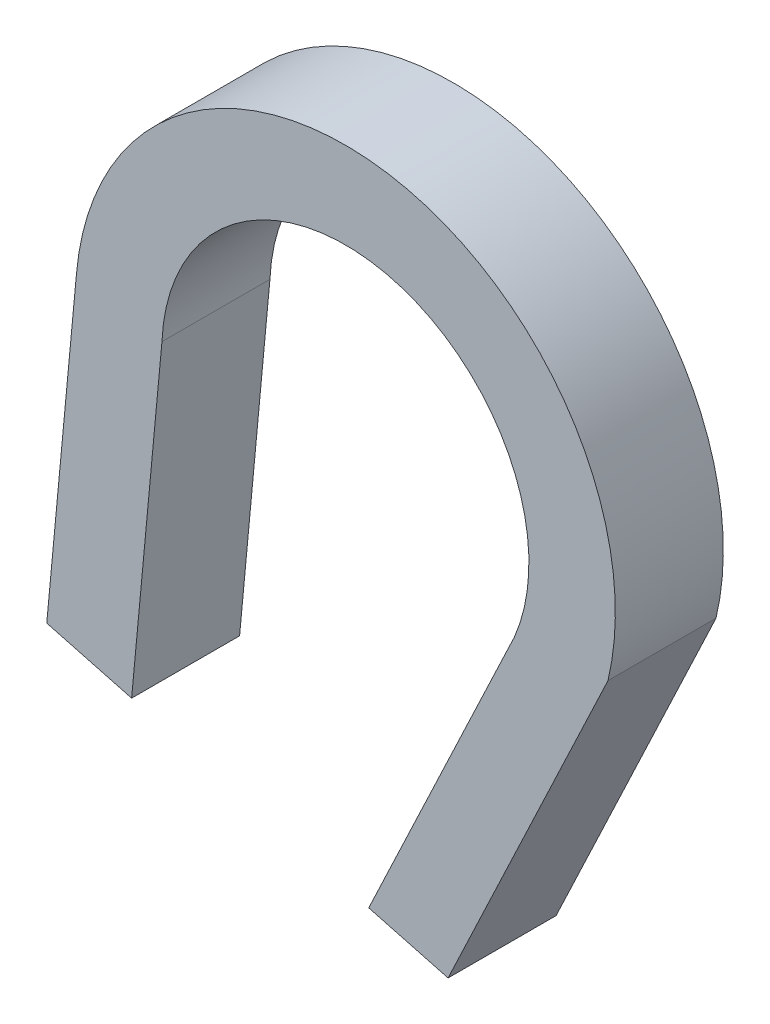
from build123d import *

# Parameters (mm, degrees)
BOSS_EXTRUDE3_DEPTH = 10


with BuildPart() as part:
    # Sketch1 → Boss-Extrude3 (new body)
    with BuildSketch(Plane.XY):
        with BuildLine():
            ThreePointArc((-16.983639344, 0.745650472), (4.47244562, 16.401135027), (15.011154971, -7.97904922))
            Line((15.011154971, -7.97904922), (2.166364839, -35.090142272))
            Line((2.166364839, -35.090142272), (9.512349642, -37.042324061))
            Line((9.512349642, -37.042324061), (24.321378156, -5.785375063))
            ThreePointArc((24.321378156, -5.785375063), (3.991578447, 24.679288918), (-24.905084284, 2.176413753))
            Line((-24.905084284, 2.176413753), (-27.653316536, -27.165617446))
            Line((-27.653316536, -27.165617446), (-19.793498246, -29.254349528))
            Line((-19.793498246, -29.254349528), (-16.983639344, 0.745650472))
        make_face()
    extrude(amount=BOSS_EXTRUDE3_DEPTH)


solid = part.part
